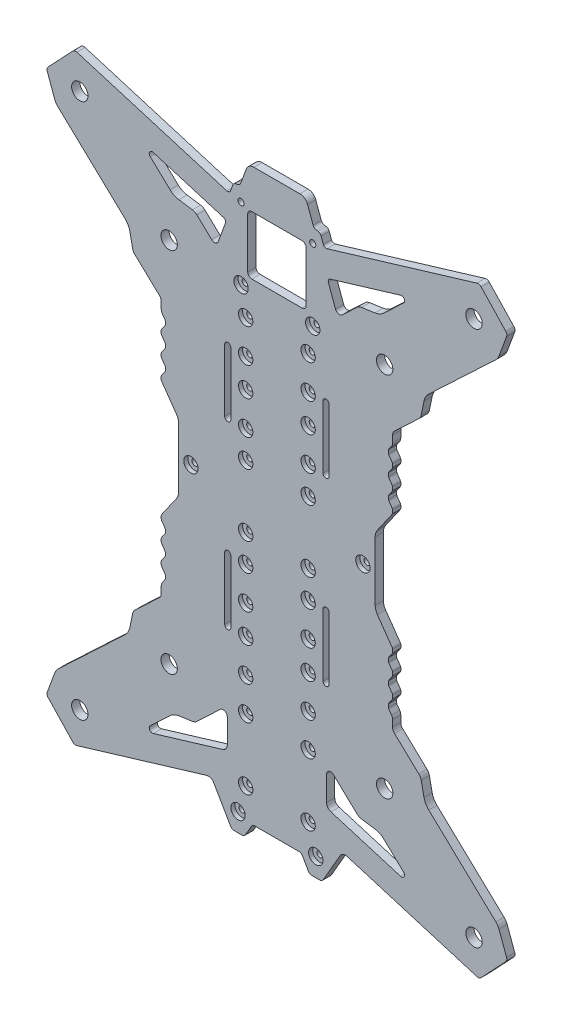
from build123d import *

# Parameters (mm, degrees)
MODEL_R             = 1.5
MODEL_R_2           = 4
BOSS_EXTRUDE1_DEPTH = 4
CUT_EXTRUDE1_START  = -2
SKETCH2_R           = 3.5
SKETCH2_R_2         = 1.5
CUT_EXTRUDE1_DEPTH  = 2


with BuildPart() as part:
    # Model → Boss-Extrude1 (new body)
    with BuildSketch(Plane.XY):
        with BuildLine():
            Line((261.034392191, 314.782999023), (273.061648382, 302.032656534))
            ThreePointArc((273.061648382, 302.032656534), (273.565856978, 301.062828157), (273.484893514, 299.972764714))
            Line((273.484893514, 299.972764714), (269.784614814, 289.86483769))
            ThreePointArc((269.784614814, 289.86483769), (269.160003791, 288.625512695), (268.26736368, 287.562846704))
            Line((268.26736368, 287.562846704), (235.488392783, 256.642773314))
            ThreePointArc((235.488392783, 256.642773314), (233.992515204, 254.722726466), (233.143240584, 252.441726192))
            Line((233.143240584, 252.441726192), (231.792450322, 245.902694328))
            ThreePointArc((231.792450322, 245.902694328), (231.367815262, 244.762192559), (230.619877947, 243.802167042))
            Line((230.619877947, 243.802167042), (218.752224369, 232.607528134))
            ThreePointArc((218.752224369, 232.607528134), (218.056165205, 231.613589887), (217.810761554, 230.425234451))
            Line((217.810761554, 230.425234451), (217.810761554, 227.216127826))
            ThreePointArc((217.810761554, 227.216127826), (217.671912001, 226.314011906), (217.268217725, 225.495401336))
            Line((217.268217725, 225.495401336), (215.991609169, 223.672214462))
            ThreePointArc((215.991609169, 223.672214462), (215.857044411, 223.399344272), (215.810761226, 223.098638965))
            Line((215.810761226, 223.098638965), (215.810761226, 221.729233427))
            ThreePointArc((215.810761226, 221.729233427), (215.857044411, 221.428528121), (215.991609169, 221.155657931))
            Line((215.991609169, 221.155657931), (217.629913611, 218.815918578))
            ThreePointArc((217.629913611, 218.815918578), (217.76447837, 218.543048389), (217.810761554, 218.242343082))
            Line((217.810761554, 218.242343082), (217.810761554, 216.872937544))
            ThreePointArc((217.810761554, 216.872937544), (217.76447837, 216.572232237), (217.629913611, 216.299362047))
            Line((217.629913611, 216.299362047), (215.991609169, 213.959622695))
            ThreePointArc((215.991609169, 213.959622695), (215.857044411, 213.686752505), (215.810761226, 213.386047198))
            Line((215.810761226, 213.386047198), (215.810761226, 212.01664166))
            ThreePointArc((215.810761226, 212.01664166), (215.857044411, 211.715936353), (215.991609169, 211.443066163))
            Line((215.991609169, 211.443066163), (217.629913611, 209.103326811))
            ThreePointArc((217.629913611, 209.103326811), (217.76447837, 208.830456621), (217.810761554, 208.529751314))
            Line((217.810761554, 208.529751314), (217.810761554, 207.160345777))
            ThreePointArc((217.810761554, 207.160345777), (217.76447837, 206.85964047), (217.629913611, 206.58677028))
            Line((217.629913611, 206.58677028), (215.991609169, 204.247030927))
            ThreePointArc((215.991609169, 204.247030927), (215.85704385, 203.974158961), (215.810761226, 203.673451705))
            Line((215.810761226, 203.673451705), (215.810761226, 202.304049893))
            ThreePointArc((215.810761226, 202.304049893), (215.857044411, 202.003344586), (215.991609169, 201.730474396))
            Line((215.991609169, 201.730474396), (217.629913611, 199.390733181))
            ThreePointArc((217.629913611, 199.390733181), (217.76447837, 199.117862991), (217.810761554, 198.817157684))
            Line((217.810761554, 198.817157684), (217.810761554, 197.447755872))
            ThreePointArc((217.810761554, 197.447755872), (217.76447865, 197.147049591), (217.629913611, 196.874178513))
            Line((217.629913611, 196.874178513), (210.395850612, 186.542864455))
            ThreePointArc((210.395850612, 186.542864455), (209.588461221, 184.905640652), (209.310762955, 183.101405887))
            Line((209.310762955, 183.101405887), (209.310762955, 154.232495962))
            ThreePointArc((209.310762955, 154.232495962), (209.588461221, 152.428261198), (210.395850612, 150.791037394))
            Line((210.395850612, 150.791037394), (217.629913611, 140.459723337))
            ThreePointArc((217.629913611, 140.459723337), (217.76447865, 140.186852259), (217.810761554, 139.886145978))
            Line((217.810761554, 139.886145978), (217.810761554, 138.516744165))
            ThreePointArc((217.810761554, 138.516744165), (217.76447837, 138.216038858), (217.629913611, 137.943168669))
            Line((217.629913611, 137.943168669), (215.991609169, 135.603427453))
            ThreePointArc((215.991609169, 135.603427453), (215.857044411, 135.330557264), (215.810761226, 135.029851957))
            Line((215.810761226, 135.029851957), (215.810761226, 133.660450144))
            ThreePointArc((215.810761226, 133.660450144), (215.85704385, 133.359742889), (215.991609169, 133.086870922))
            Line((215.991609169, 133.086870922), (217.629913611, 130.74713157))
            ThreePointArc((217.629913611, 130.74713157), (217.76447837, 130.47426138), (217.810761554, 130.173556073))
            Line((217.810761554, 130.173556073), (217.810761554, 128.804150535))
            ThreePointArc((217.810761554, 128.804150535), (217.76447837, 128.503445228), (217.629913611, 128.230575039))
            Line((217.629913611, 128.230575039), (215.991609169, 125.890835686))
            ThreePointArc((215.991609169, 125.890835686), (215.857044411, 125.617965496), (215.810761226, 125.31726019))
            Line((215.810761226, 125.31726019), (215.810761226, 123.947854652))
            ThreePointArc((215.810761226, 123.947854652), (215.857044411, 123.647149345), (215.991609169, 123.374279155))
            Line((215.991609169, 123.374279155), (217.629913611, 121.034539803))
            ThreePointArc((217.629913611, 121.034539803), (217.76447837, 120.761669613), (217.810761554, 120.460964306))
            Line((217.810761554, 120.460964306), (217.810761554, 119.091558768))
            ThreePointArc((217.810761554, 119.091558768), (217.76447837, 118.790853461), (217.629913611, 118.517983271))
            Line((217.629913611, 118.517983271), (215.991609169, 116.178243919))
            ThreePointArc((215.991609169, 116.178243919), (215.857044411, 115.905373729), (215.810761226, 115.604668422))
            Line((215.810761226, 115.604668422), (215.810761226, 114.235262884))
            ThreePointArc((215.810761226, 114.235262884), (215.857044411, 113.934557578), (215.991609169, 113.661687388))
            Line((215.991609169, 113.661687388), (217.268217725, 111.838500513))
            ThreePointArc((217.268217725, 111.838500513), (217.671912001, 111.019889944), (217.810761554, 110.117774023))
            Line((217.810761554, 110.117774023), (217.810761554, 106.908667399))
            ThreePointArc((217.810761554, 106.908667399), (218.056165205, 105.720311962), (218.752224369, 104.726373716))
            Line((218.752224369, 104.726373716), (230.619877947, 93.531734808))
            ThreePointArc((230.619877947, 93.531734808), (231.367815262, 92.571709291), (231.792450322, 91.431207521))
            Line((231.792450322, 91.431207521), (233.143240584, 84.892175658))
            ThreePointArc((233.143240584, 84.892175658), (233.992515204, 82.611175384), (235.488392783, 80.691128536))
            Line((235.488392783, 80.691128536), (268.26736368, 49.771055146))
            ThreePointArc((268.26736368, 49.771055146), (269.160003791, 48.708389155), (269.784614814, 47.46906416))
            Line((269.784614814, 47.46906416), (273.484893514, 37.361137136))
            ThreePointArc((273.484893514, 37.361137136), (273.565856978, 36.271073693), (273.061648382, 35.301245315))
            Line((273.061648382, 35.301245315), (261.034392191, 22.550902827))
            ThreePointArc((261.034392191, 22.550902827), (260.095615458, 21.990999971), (259.002685917, 22.008262141))
            Line((259.002685917, 22.008262141), (195.639953388, 41.094414456))
            ThreePointArc((195.639953388, 41.094414456), (193.669430203, 41.010883841), (192.17661619, 39.721913202))
            Line((192.17661619, 39.721913202), (183.941960705, 25.45907305))
            ThreePointArc((183.941960705, 25.45907305), (183.209910003, 24.727020953), (182.209909333, 24.459071024))
            Line((182.209909333, 24.459071024), (178.411616383, 24.459071024))
            ThreePointArc((178.411616383, 24.459071024), (177.411615713, 24.727020953), (176.67956501, 25.45907305))
            Line((176.67956501, 25.45907305), (173.792813344, 30.459068282))
            ThreePointArc((173.792813344, 30.459068282), (173.060763045, 31.191120147), (172.060762902, 31.459070309))
            Line((172.060762902, 31.459070309), (150.560762172, 31.459070309))
            ThreePointArc((150.560762172, 31.459070309), (149.56076203, 31.191120147), (148.828711731, 30.459068282))
            Line((148.828711731, 30.459068282), (145.941960064, 25.45907305))
            ThreePointArc((145.941960064, 25.45907305), (145.209909362, 24.727020953), (144.209908692, 24.459071024))
            Line((144.209908692, 24.459071024), (140.411615742, 24.459071024))
            ThreePointArc((140.411615742, 24.459071024), (139.411615072, 24.727020953), (138.67956437, 25.45907305))
            Line((138.67956437, 25.45907305), (130.444908885, 39.721913202))
            ThreePointArc((130.444908885, 39.721913202), (128.952094872, 41.010883841), (126.981571687, 41.094414456))
            Line((126.981571687, 41.094414456), (63.618839157, 22.008262141))
            ThreePointArc((63.618839157, 22.008262141), (62.525909617, 21.990999971), (61.587132884, 22.550902827))
            Line((61.587132884, 22.550902827), (49.559876693, 35.301245315))
            ThreePointArc((49.559876693, 35.301245315), (49.055668097, 36.271073693), (49.136631561, 37.361137136))
            Line((49.136631561, 37.361137136), (52.836910261, 47.46906416))
            ThreePointArc((52.836910261, 47.46906416), (53.461521284, 48.708389155), (54.354161394, 49.771055146))
            Line((54.354161394, 49.771055146), (87.133132292, 80.691128536))
            ThreePointArc((87.133132292, 80.691128536), (88.629009871, 82.611175384), (89.478284491, 84.892175658))
            Line((89.478284491, 84.892175658), (90.829074753, 91.431207521))
            ThreePointArc((90.829074753, 91.431207521), (91.253709813, 92.571709291), (92.001647128, 93.531734808))
            Line((92.001647128, 93.531734808), (103.869300706, 104.726373716))
            ThreePointArc((103.869300706, 104.726373716), (104.565359869, 105.720311962), (104.810763521, 106.908667399))
            Line((104.810763521, 106.908667399), (104.810763521, 110.117774023))
            ThreePointArc((104.810763521, 110.117774023), (104.949613074, 111.019889944), (105.353307349, 111.838500513))
            Line((105.353307349, 111.838500513), (106.629915906, 113.661687388))
            ThreePointArc((106.629915906, 113.661687388), (106.764480664, 113.934557578), (106.810763849, 114.235262884))
            Line((106.810763849, 114.235262884), (106.810763849, 115.604668422))
            ThreePointArc((106.810763849, 115.604668422), (106.764480664, 115.905373729), (106.629915906, 116.178243919))
            Line((106.629915906, 116.178243919), (104.991611464, 118.517983271))
            ThreePointArc((104.991611464, 118.517983271), (104.857046705, 118.790853461), (104.810763521, 119.091558768))
            Line((104.810763521, 119.091558768), (104.810763521, 120.460964306))
            ThreePointArc((104.810763521, 120.460964306), (104.857046705, 120.761669613), (104.991611464, 121.034539803))
            Line((104.991611464, 121.034539803), (106.629915906, 123.374279155))
            ThreePointArc((106.629915906, 123.374279155), (106.764480664, 123.647149345), (106.810763849, 123.947854652))
            Line((106.810763849, 123.947854652), (106.810763849, 125.31726019))
            ThreePointArc((106.810763849, 125.31726019), (106.764480664, 125.617965496), (106.629915906, 125.890835686))
            Line((106.629915906, 125.890835686), (104.991611464, 128.230575039))
            ThreePointArc((104.991611464, 128.230575039), (104.857046705, 128.503445229), (104.810763521, 128.804150535))
            Line((104.810763521, 128.804150535), (104.810763521, 130.173556073))
            ThreePointArc((104.810763521, 130.173556073), (104.857046705, 130.47426138), (104.991611464, 130.74713157))
            Line((104.991611464, 130.74713157), (106.629915906, 133.086870922))
            ThreePointArc((106.629915906, 133.086870922), (106.764481224, 133.359742889), (106.810763849, 133.660450144))
            Line((106.810763849, 133.660450144), (106.810763849, 135.029851957))
            ThreePointArc((106.810763849, 135.029851957), (106.764480664, 135.330557264), (106.629915906, 135.603427453))
            Line((106.629915906, 135.603427453), (104.991611464, 137.943168669))
            ThreePointArc((104.991611464, 137.943168669), (104.857046705, 138.216038858), (104.810763521, 138.516744165))
            Line((104.810763521, 138.516744165), (104.810763521, 139.886145978))
            ThreePointArc((104.810763521, 139.886145978), (104.857046425, 140.186852259), (104.991611464, 140.459723337))
            Line((104.991611464, 140.459723337), (112.225674463, 150.791037394))
            ThreePointArc((112.225674463, 150.791037394), (113.033063854, 152.428261198), (113.31076212, 154.232495962))
            Line((113.31076212, 154.232495962), (113.31076212, 183.101405887))
            ThreePointArc((113.31076212, 183.101405887), (113.033063854, 184.905640652), (112.225674463, 186.542864455))
            Line((112.225674463, 186.542864455), (104.991611464, 196.874178513))
            ThreePointArc((104.991611464, 196.874178513), (104.857046425, 197.147049591), (104.810763521, 197.447755872))
            Line((104.810763521, 197.447755872), (104.810763521, 198.817157684))
            ThreePointArc((104.810763521, 198.817157684), (104.857046705, 199.117862991), (104.991611464, 199.390733181))
            Line((104.991611464, 199.390733181), (106.629915906, 201.730474396))
            ThreePointArc((106.629915906, 201.730474396), (106.764480664, 202.003344586), (106.810763849, 202.304049893))
            Line((106.810763849, 202.304049893), (106.810763849, 203.673451705))
            ThreePointArc((106.810763849, 203.673451705), (106.764481224, 203.974158961), (106.629915906, 204.247030927))
            Line((106.629915906, 204.247030927), (104.991611464, 206.58677028))
            ThreePointArc((104.991611464, 206.58677028), (104.857046705, 206.85964047), (104.810763521, 207.160345777))
            Line((104.810763521, 207.160345777), (104.810763521, 208.529751314))
            ThreePointArc((104.810763521, 208.529751314), (104.857046705, 208.830456621), (104.991611464, 209.103326811))
            Line((104.991611464, 209.103326811), (106.629915906, 211.443066163))
            ThreePointArc((106.629915906, 211.443066163), (106.764480664, 211.715936353), (106.810763849, 212.01664166))
            Line((106.810763849, 212.01664166), (106.810763849, 213.386047198))
            ThreePointArc((106.810763849, 213.386047198), (106.764480664, 213.686752505), (106.629915906, 213.959622695))
            Line((106.629915906, 213.959622695), (104.991611464, 216.299362047))
            ThreePointArc((104.991611464, 216.299362047), (104.857046705, 216.572232237), (104.810763521, 216.872937544))
            Line((104.810763521, 216.872937544), (104.810763521, 218.242343082))
            ThreePointArc((104.810763521, 218.242343082), (104.857046705, 218.543048389), (104.991611464, 218.815918578))
            Line((104.991611464, 218.815918578), (106.629915906, 221.155657931))
            ThreePointArc((106.629915906, 221.155657931), (106.764480664, 221.428528121), (106.810763849, 221.729233427))
            Line((106.810763849, 221.729233427), (106.810763849, 223.098638965))
            ThreePointArc((106.810763849, 223.098638965), (106.764480664, 223.399344272), (106.629915906, 223.672214462))
            Line((106.629915906, 223.672214462), (105.353307349, 225.495401336))
            ThreePointArc((105.353307349, 225.495401336), (104.949613074, 226.314011906), (104.810763521, 227.216127826))
            Line((104.810763521, 227.216127826), (104.810763521, 230.425234451))
            ThreePointArc((104.810763521, 230.425234451), (104.565359869, 231.613589887), (103.869300706, 232.607528134))
            Line((103.869300706, 232.607528134), (92.001647128, 243.802167042))
            ThreePointArc((92.001647128, 243.802167042), (91.253709813, 244.762192559), (90.829074753, 245.902694328))
            Line((90.829074753, 245.902694328), (89.478284491, 252.441726192))
            ThreePointArc((89.478284491, 252.441726192), (88.629009871, 254.722726466), (87.133132292, 256.642773314))
            Line((87.133132292, 256.642773314), (54.354161394, 287.562846704))
            ThreePointArc((54.354161394, 287.562846704), (53.461521284, 288.625512695), (52.836910261, 289.86483769))
            Line((52.836910261, 289.86483769), (49.136631561, 299.972764714))
            ThreePointArc((49.136631561, 299.972764714), (49.055668097, 301.062828157), (49.559876693, 302.032656534))
            Line((49.559876693, 302.032656534), (61.587132884, 314.782999023))
            ThreePointArc((61.587132884, 314.782999023), (62.525909617, 315.342901879), (63.618839157, 315.325639708))
            Line((63.618839157, 315.325639708), (136.809913812, 293.278984292))
            ThreePointArc((136.809913812, 293.278984292), (137.914608643, 293.374219842), (138.652082903, 294.202200635))
            Line((138.652082903, 294.202200635), (139.728013796, 297.158307894))
            ThreePointArc((139.728013796, 297.158307894), (140.321825305, 298.006352282), (141.260102762, 298.443875773))
            Line((141.260102762, 298.443875773), (142.112970723, 298.594258292))
            ThreePointArc((142.112970723, 298.594258292), (143.051251128, 299.031788099), (143.645059688, 299.879841073))
            Line((143.645059688, 299.879841073), (146.325001864, 307.242922051))
            ThreePointArc((146.325001864, 307.242922051), (147.789467359, 309.151448821), (150.083773209, 309.874839647))
            Line((150.083773209, 309.874839647), (172.537751866, 309.874839647))
            ThreePointArc((172.537751866, 309.874839647), (174.832057716, 309.151448821), (176.296523211, 307.242922051))
            Line((176.296523211, 307.242922051), (178.976465387, 299.879841073))
            ThreePointArc((178.976465387, 299.879841073), (179.570273946, 299.031788099), (180.508554352, 298.594258292))
            Line((180.508554352, 298.594258292), (181.361422313, 298.443875773))
            ThreePointArc((181.361422313, 298.443875773), (182.29969977, 298.006352282), (182.893511278, 297.158307894))
            Line((182.893511278, 297.158307894), (183.969442172, 294.202200635))
            ThreePointArc((183.969442172, 294.202200635), (184.706916432, 293.374219842), (185.811611263, 293.278984292))
            Line((185.811611263, 293.278984292), (259.002685917, 315.325639708))
            ThreePointArc((259.002685917, 315.325639708), (260.095615458, 315.342901879), (261.034392191, 314.782999023))
        make_face()
        with Locations((178.810762537, 292.022001283)):
            Circle(MODEL_R, mode=Mode.SUBTRACT)
        with Locations((213.945462155, 258.31672503)):
            Circle(MODEL_R_2, mode=Mode.SUBTRACT)
        with Locations((257.591400323, 299.487492346)):
            Circle(MODEL_R_2, mode=Mode.SUBTRACT)
        with Locations((65.030124751, 299.487492346)):
            Circle(MODEL_R_2, mode=Mode.SUBTRACT)
        with Locations((108.67606292, 258.31672503)):
            Circle(MODEL_R_2, mode=Mode.SUBTRACT)
        with Locations((108.67606292, 79.017176819)):
            Circle(MODEL_R_2, mode=Mode.SUBTRACT)
        with Locations((65.030124751, 37.846409503)):
            Circle(MODEL_R_2, mode=Mode.SUBTRACT)
        with Locations((257.591400323, 37.846409503)):
            Circle(MODEL_R_2, mode=Mode.SUBTRACT)
        with Locations((213.945462155, 79.017176819)):
            Circle(MODEL_R_2, mode=Mode.SUBTRACT)
        with Locations((143.810762537, 292.022001283)):
            Circle(MODEL_R, mode=Mode.SUBTRACT)
        with Locations((176.560762537, 227.916950925)):
            Circle(MODEL_R, mode=Mode.SUBTRACT)
        with Locations((146.060762537, 227.916950925)):
            Circle(MODEL_R, mode=Mode.SUBTRACT)
        with Locations((146.060762537, 123.541950925)):
            Circle(MODEL_R, mode=Mode.SUBTRACT)
        with Locations((176.560762537, 123.541950925)):
            Circle(MODEL_R, mode=Mode.SUBTRACT)
        with Locations((146.060762537, 93.041950925)):
            Circle(MODEL_R, mode=Mode.SUBTRACT)
        with Locations((176.560762537, 93.041950925)):
            Circle(MODEL_R, mode=Mode.SUBTRACT)
        with Locations((180.310762537, 33.459065681)):
            Circle(MODEL_R, mode=Mode.SUBTRACT)
        with Locations((142.310762537, 33.459065681)):
            Circle(MODEL_R, mode=Mode.SUBTRACT)
        with Locations((176.560762537, 76.666950925)):
            Circle(MODEL_R, mode=Mode.SUBTRACT)
        with Locations((146.060762537, 76.666950925)):
            Circle(MODEL_R, mode=Mode.SUBTRACT)
        with Locations((146.060762537, 109.416950925)):
            Circle(MODEL_R, mode=Mode.SUBTRACT)
        with Locations((119.310762537, 168.666950925)):
            Circle(MODEL_R, mode=Mode.SUBTRACT)
        with Locations((176.560762537, 139.916950925)):
            Circle(MODEL_R, mode=Mode.SUBTRACT)
        with Locations((146.060762537, 139.916950925)):
            Circle(MODEL_R, mode=Mode.SUBTRACT)
        with Locations((146.060762537, 213.791950925)):
            Circle(MODEL_R, mode=Mode.SUBTRACT)
        with Locations((176.560762537, 213.791950925)):
            Circle(MODEL_R, mode=Mode.SUBTRACT)
        with Locations((176.560762537, 109.416950925)):
            Circle(MODEL_R, mode=Mode.SUBTRACT)
        with Locations((176.560762537, 197.416950925)):
            Circle(MODEL_R, mode=Mode.SUBTRACT)
        with Locations((176.560762537, 244.291950925)):
            Circle(MODEL_R, mode=Mode.SUBTRACT)
        with Locations((203.310762537, 168.666950925)):
            Circle(MODEL_R, mode=Mode.SUBTRACT)
        with Locations((143.810762537, 257.022001283)):
            Circle(MODEL_R, mode=Mode.SUBTRACT)
        with Locations((178.810762537, 257.022001283)):
            Circle(MODEL_R, mode=Mode.SUBTRACT)
        with Locations((146.060762537, 244.291950925)):
            Circle(MODEL_R, mode=Mode.SUBTRACT)
        with Locations((146.060762537, 46.166950925)):
            Circle(MODEL_R, mode=Mode.SUBTRACT)
        with Locations((146.060762537, 197.416950925)):
            Circle(MODEL_R, mode=Mode.SUBTRACT)
        with Locations((176.560762537, 46.166950925)):
            Circle(MODEL_R, mode=Mode.SUBTRACT)
        with Locations((146.060762537, 183.916950925)):
            Circle(MODEL_R, mode=Mode.SUBTRACT)
        with Locations((146.060762537, 153.416950925)):
            Circle(MODEL_R, mode=Mode.SUBTRACT)
        with Locations((176.560762537, 153.416950925)):
            Circle(MODEL_R, mode=Mode.SUBTRACT)
        with Locations((176.560762537, 183.916950925)):
            Circle(MODEL_R, mode=Mode.SUBTRACT)
        with BuildLine():
            Line((183.810763431, 197.416951446), (183.810763431, 227.916951789))
            ThreePointArc((183.810763431, 227.916951789), (185.310762746, 229.416951104), (186.810762061, 227.916951789))
            Line((186.810762061, 227.916951789), (186.810762061, 197.416951446))
            ThreePointArc((186.810762061, 197.416951446), (185.310762746, 195.916952132), (183.810763431, 197.416951446))
        make_face(mode=Mode.SUBTRACT)
        with BuildLine():
            Line((138.810761643, 139.916950403), (138.810761643, 109.416950061))
            ThreePointArc((138.810761643, 109.416950061), (137.310762329, 107.916950746), (135.810763014, 109.416950061))
            Line((135.810763014, 109.416950061), (135.810763014, 139.916950403))
            ThreePointArc((135.810763014, 139.916950403), (137.310762329, 141.416949718), (138.810761643, 139.916950403))
        make_face(mode=Mode.SUBTRACT)
        with BuildLine():
            Line((186.810762061, 139.916950403), (186.810762061, 109.416950061))
            ThreePointArc((186.810762061, 109.416950061), (185.310762746, 107.916950746), (183.810763431, 109.416950061))
            Line((183.810763431, 109.416950061), (183.810763431, 139.916950403))
            ThreePointArc((183.810763431, 139.916950403), (185.310762746, 141.416949718), (186.810762061, 139.916950403))
        make_face(mode=Mode.SUBTRACT)
        with BuildLine():
            Line((135.810763014, 197.416951446), (135.810763014, 227.916951789))
            ThreePointArc((135.810763014, 227.916951789), (137.310762329, 229.416951104), (138.810761643, 227.916951789))
            Line((138.810761643, 227.916951789), (138.810761643, 197.416951446))
            ThreePointArc((138.810761643, 197.416951446), (137.310762329, 195.916952132), (135.810763014, 197.416951446))
        make_face(mode=Mode.SUBTRACT)
        with BuildLine():
            Line((147.06076253, 264.094478949), (147.06076253, 288.594476445))
            ThreePointArc((147.06076253, 288.594476445), (147.646550285, 290.008687927), (149.060762858, 290.594473048))
            Line((149.060762858, 290.594473048), (173.560762217, 290.594473048))
            ThreePointArc((173.560762217, 290.594473048), (174.97497479, 290.008687927), (175.560762545, 288.594476445))
            Line((175.560762545, 288.594476445), (175.560762545, 264.094478949))
            ThreePointArc((175.560762545, 264.094478949), (174.974977424, 262.68026265), (173.560762217, 262.094474896))
            Line((173.560762217, 262.094474896), (149.060762858, 262.094474896))
            ThreePointArc((149.060762858, 262.094474896), (147.646547651, 262.68026265), (147.06076253, 264.094478949))
        make_face(mode=Mode.SUBTRACT)
        with BuildLine():
            Line((133.688403664, 72.367697521), (122.193541748, 61.524711116))
            ThreePointArc((122.193541748, 61.524711116), (121.191534815, 60.834033021), (120.028213037, 60.476630493))
            Line((120.028213037, 60.476630493), (113.421537353, 59.509470625))
            ThreePointArc((113.421537353, 59.509470625), (111.094892422, 58.79465859), (109.09087993, 57.413294478))
            Line((109.09087993, 57.413294478), (99.422797931, 48.293493255))
            ThreePointArc((99.422797931, 48.293493255), (99.153636079, 46.451307287), (100.884698702, 45.766092403))
            Line((100.884698702, 45.766092403), (134.92602147, 56.020035906))
            ThreePointArc((134.92602147, 56.020035906), (136.468642418, 57.103103666), (137.060761822, 58.892547651))
            Line((137.060761822, 58.892547651), (137.060761822, 70.912830098))
            ThreePointArc((137.060761822, 70.912830098), (135.85300129, 72.749229936), (133.688403664, 72.367697521))
        make_face(mode=Mode.SUBTRACT)
        with BuildLine():
            Line((209.199987722, 59.509470625), (202.593312038, 60.476630493))
            ThreePointArc((202.593312038, 60.476630493), (201.42999026, 60.834033021), (200.427983327, 61.524711116))
            Line((200.427983327, 61.524711116), (188.933121411, 72.367697521))
            ThreePointArc((188.933121411, 72.367697521), (186.768523785, 72.749229936), (185.560763253, 70.912830098))
            Line((185.560763253, 70.912830098), (185.560763253, 58.892547651))
            ThreePointArc((185.560763253, 58.892547651), (186.152882656, 57.103103666), (187.695503605, 56.020035906))
            Line((187.695503605, 56.020035906), (221.736826373, 45.766092403))
            ThreePointArc((221.736826373, 45.766092403), (223.467888996, 46.451307287), (223.198727144, 48.293493255))
            Line((223.198727144, 48.293493255), (213.530645145, 57.413294478))
            ThreePointArc((213.530645145, 57.413294478), (211.526632653, 58.79465859), (209.199987722, 59.509470625))
        make_face(mode=Mode.SUBTRACT)
        with BuildLine():
            Line((113.421537353, 277.824431224), (120.028213037, 276.857271357))
            ThreePointArc((120.028213037, 276.857271357), (121.191534815, 276.499868829), (122.193541748, 275.809190734))
            Line((122.193541748, 275.809190734), (129.428796841, 268.98424284))
            ThreePointArc((129.428796841, 268.98424284), (131.262472413, 268.49303928), (132.680541275, 269.755072458))
            Line((132.680541275, 269.755072458), (136.150926722, 279.289878471))
            ThreePointArc((136.150926722, 279.289878471), (136.082401816, 280.474972249), (135.17401777, 281.239158972))
            Line((135.17401777, 281.239158972), (100.884698702, 291.567809446))
            ThreePointArc((100.884698702, 291.567809446), (99.153636079, 290.882594562), (99.422797931, 289.040408595))
            Line((99.422797931, 289.040408595), (109.09087993, 279.920607372))
            ThreePointArc((109.09087993, 279.920607372), (111.094892422, 278.539243259), (113.421537353, 277.824431224))
        make_face(mode=Mode.SUBTRACT)
        with BuildLine():
            Line((193.192728234, 268.98424284), (200.427983327, 275.809190734))
            ThreePointArc((200.427983327, 275.809190734), (201.42999026, 276.499868829), (202.593312038, 276.857271357))
            Line((202.593312038, 276.857271357), (209.199987722, 277.824431224))
            ThreePointArc((209.199987722, 277.824431224), (211.526632653, 278.539243259), (213.530645145, 279.920607372))
            Line((213.530645145, 279.920607372), (223.198727144, 289.040408595))
            ThreePointArc((223.198727144, 289.040408595), (223.467888996, 290.882594562), (221.736826373, 291.567809446))
            Line((221.736826373, 291.567809446), (187.447507305, 281.239158972))
            ThreePointArc((187.447507305, 281.239158972), (186.539123259, 280.474972249), (186.470598353, 279.289878471))
            Line((186.470598353, 279.289878471), (189.9409838, 269.755072458))
            ThreePointArc((189.9409838, 269.755072458), (191.359052662, 268.49303928), (193.192728234, 268.98424284))
        make_face(mode=Mode.SUBTRACT)
    extrude(amount=BOSS_EXTRUDE1_DEPTH)

    # Sketch2 → Cut-Extrude1 (cut)
    # profile 1 of 30: a face of its own
    with BuildSketch(Plane.XY.offset(4).offset(CUT_EXTRUDE1_START)):
        with Locations((176.560762537, 46.166950925)):
            Circle(SKETCH2_R)
    # profile 2 of 30: a face of its own
    with BuildSketch(Plane.XY.offset(4).offset(CUT_EXTRUDE1_START)):
        with Locations((180.310762537, 33.459065681)):
            Circle(SKETCH2_R)
    # profile 3 of 30: a face of its own
    with BuildSketch(Plane.XY.offset(4).offset(CUT_EXTRUDE1_START)):
        with Locations((142.310762537, 33.459065681)):
            Circle(SKETCH2_R)
    # profile 4 of 30: a face of its own
    with BuildSketch(Plane.XY.offset(4).offset(CUT_EXTRUDE1_START)):
        with Locations((146.060762537, 46.166950925)):
            Circle(SKETCH2_R)
    # profile 5 of 30: a face of its own
    with BuildSketch(Plane.XY.offset(4).offset(CUT_EXTRUDE1_START)):
        with Locations((176.560762537, 76.666950925)):
            Circle(SKETCH2_R)
    # profile 6 of 30: a face of its own
    with BuildSketch(Plane.XY.offset(4).offset(CUT_EXTRUDE1_START)):
        with Locations((146.060762537, 76.666950925)):
            Circle(SKETCH2_R)
    # profile 7 of 30: a face of its own
    with BuildSketch(Plane.XY.offset(4).offset(CUT_EXTRUDE1_START)):
        with Locations((146.060762537, 93.041950925)):
            Circle(SKETCH2_R)
    # profile 8 of 30: a face of its own
    with BuildSketch(Plane.XY.offset(4).offset(CUT_EXTRUDE1_START)):
        with Locations((176.560762537, 93.041950925)):
            Circle(SKETCH2_R)
    # profile 9 of 30: a face of its own
    with BuildSketch(Plane.XY.offset(4).offset(CUT_EXTRUDE1_START)):
        with Locations((176.560762537, 109.416950925)):
            Circle(SKETCH2_R)
    # profile 10 of 30: a face of its own
    with BuildSketch(Plane.XY.offset(4).offset(CUT_EXTRUDE1_START)):
        with Locations((146.060762537, 109.416950925)):
            Circle(SKETCH2_R)
    # profile 11 of 30: a face of its own
    with BuildSketch(Plane.XY.offset(4).offset(CUT_EXTRUDE1_START)):
        with Locations((176.560762537, 123.541950925)):
            Circle(SKETCH2_R)
    # profile 12 of 30: a face of its own
    with BuildSketch(Plane.XY.offset(4).offset(CUT_EXTRUDE1_START)):
        with Locations((146.060762537, 123.541950925)):
            Circle(SKETCH2_R)
    # profile 13 of 30: a face of its own
    with BuildSketch(Plane.XY.offset(4).offset(CUT_EXTRUDE1_START)):
        with Locations((146.060762537, 139.916950925)):
            Circle(SKETCH2_R)
    # profile 14 of 30: a face of its own
    with BuildSketch(Plane.XY.offset(4).offset(CUT_EXTRUDE1_START)):
        with Locations((176.560762537, 139.916950925)):
            Circle(SKETCH2_R)
        with Locations((176.560762537, 139.916950925)):
            Circle(SKETCH2_R_2, mode=Mode.SUBTRACT)
    # profile 15 of 30: a face of its own
    with BuildSketch(Plane.XY.offset(4).offset(CUT_EXTRUDE1_START)):
        with Locations((203.310762537, 168.666950925)):
            Circle(SKETCH2_R)
    # profile 16 of 30: a face of its own
    with BuildSketch(Plane.XY.offset(4).offset(CUT_EXTRUDE1_START)):
        with Locations((176.560762537, 153.416950925)):
            Circle(SKETCH2_R)
    # profile 17 of 30: a face of its own
    with BuildSketch(Plane.XY.offset(4).offset(CUT_EXTRUDE1_START)):
        with Locations((146.060762537, 153.416950925)):
            Circle(SKETCH2_R)
    # profile 18 of 30: a face of its own
    with BuildSketch(Plane.XY.offset(4).offset(CUT_EXTRUDE1_START)):
        with Locations((119.310762537, 168.666950925)):
            Circle(SKETCH2_R)
    # profile 19 of 30: a face of its own
    with BuildSketch(Plane.XY.offset(4).offset(CUT_EXTRUDE1_START)):
        with Locations((146.060762537, 183.916950925)):
            Circle(SKETCH2_R)
    # profile 20 of 30: a face of its own
    with BuildSketch(Plane.XY.offset(4).offset(CUT_EXTRUDE1_START)):
        with Locations((176.560762537, 183.916950925)):
            Circle(SKETCH2_R)
    # profile 21 of 30: a face of its own
    with BuildSketch(Plane.XY.offset(4).offset(CUT_EXTRUDE1_START)):
        with Locations((176.560762537, 197.416950925)):
            Circle(SKETCH2_R)
    # profile 22 of 30: a face of its own
    with BuildSketch(Plane.XY.offset(4).offset(CUT_EXTRUDE1_START)):
        with Locations((146.060762537, 197.416950925)):
            Circle(SKETCH2_R)
    # profile 23 of 30: a face of its own
    with BuildSketch(Plane.XY.offset(4).offset(CUT_EXTRUDE1_START)):
        with Locations((176.560762537, 213.791950925)):
            Circle(SKETCH2_R)
    # profile 24 of 30: a face of its own
    with BuildSketch(Plane.XY.offset(4).offset(CUT_EXTRUDE1_START)):
        with Locations((146.060762537, 213.791950925)):
            Circle(SKETCH2_R)
    # profile 25 of 30: a face of its own
    with BuildSketch(Plane.XY.offset(4).offset(CUT_EXTRUDE1_START)):
        with Locations((146.060762537, 227.916950925)):
            Circle(SKETCH2_R)
    # profile 26 of 30: a face of its own
    with BuildSketch(Plane.XY.offset(4).offset(CUT_EXTRUDE1_START)):
        with Locations((176.560762537, 227.916950925)):
            Circle(SKETCH2_R)
    # profile 27 of 30: a face of its own
    with BuildSketch(Plane.XY.offset(4).offset(CUT_EXTRUDE1_START)):
        with Locations((176.560762537, 244.291950925)):
            Circle(SKETCH2_R)
    # profile 28 of 30: a face of its own
    with BuildSketch(Plane.XY.offset(4).offset(CUT_EXTRUDE1_START)):
        with Locations((178.810762537, 257.022001283)):
            Circle(SKETCH2_R)
    # profile 29 of 30: a face of its own
    with BuildSketch(Plane.XY.offset(4).offset(CUT_EXTRUDE1_START)):
        with Locations((146.060762537, 244.291950925)):
            Circle(SKETCH2_R)
    # profile 30 of 30: a face of its own
    with BuildSketch(Plane.XY.offset(4).offset(CUT_EXTRUDE1_START)):
        with Locations((143.810762537, 257.022001283)):
            Circle(SKETCH2_R)
    extrude(amount=CUT_EXTRUDE1_DEPTH, mode=Mode.SUBTRACT)


solid = part.part
